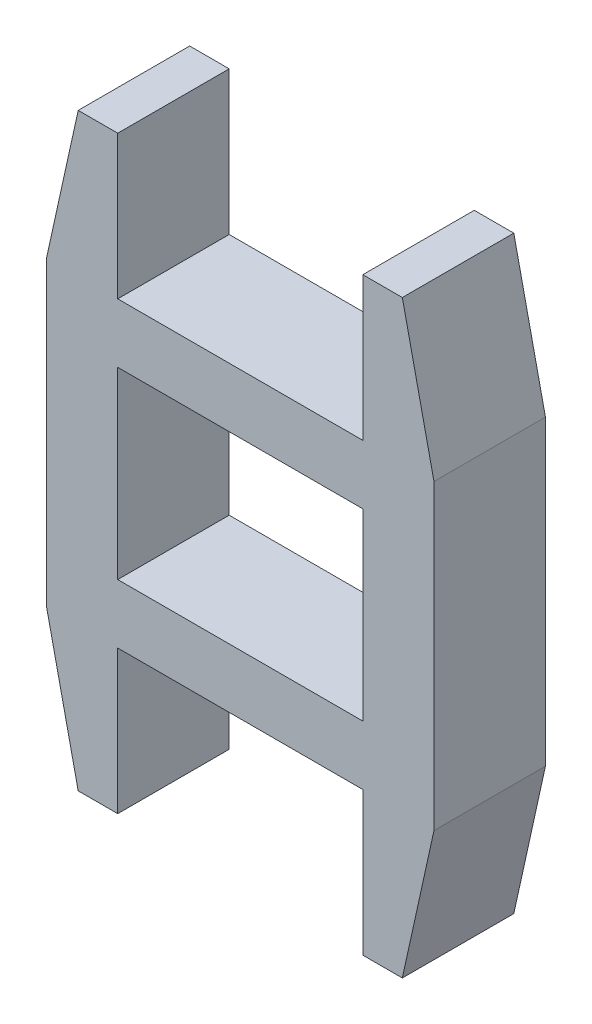
from build123d import *

# Parameters (mm, degrees)
SKETCH1_W           = 12.4
SKETCH1_H           = 9.3
BOSS_EXTRUDE1_DEPTH = 5.64


with BuildPart() as part:
    # Sketch1 → Boss-Extrude1 (new body)
    with BuildSketch(Plane.XY):
        Polygon((1245.209623553, 970.786361434), (1247.209623553, 970.786361434), (1247.209623553, 963.527195661), (1259.609623553, 963.527195661), (1259.609623553, 970.786361434), (1261.609623553, 970.786361434), (1263.209623553, 963.527195661), (1263.209623553, 948.227195661), (1261.609623553, 940.968029888), (1259.609623553, 940.968029888), (1259.609623553, 948.227195661), (1247.209623553, 948.227195661), (1247.209623553, 940.968029888), (1245.209623553, 940.968029888), (1243.609623553, 948.227195661), (1243.609623553, 963.527195661), align=None)
        with Locations((1253.409623553, 955.877195661)):
            Rectangle(SKETCH1_W, SKETCH1_H, mode=Mode.SUBTRACT)
    extrude(amount=BOSS_EXTRUDE1_DEPTH)


solid = part.part
